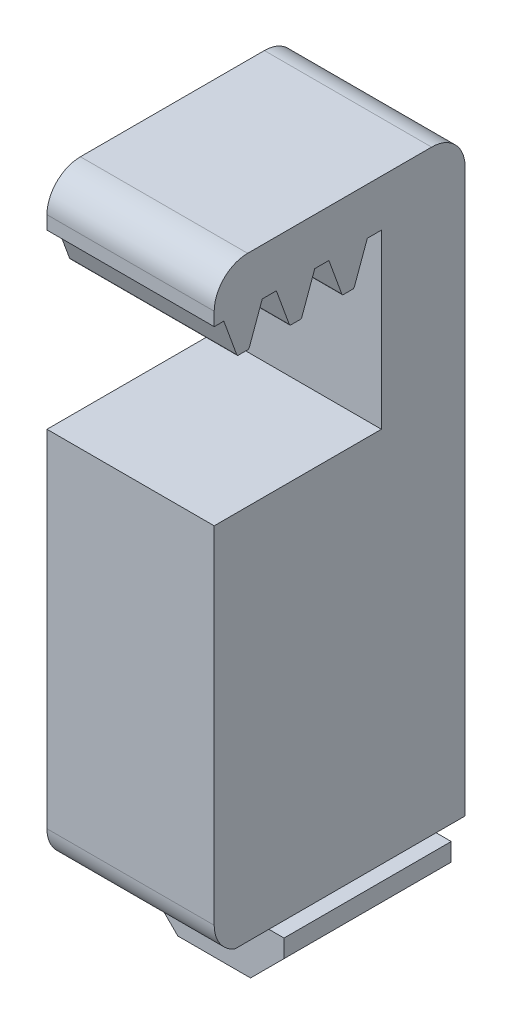
from build123d import *

# Parameters (mm, degrees)
BOSS_EXTRUDE1_DEPTH = 6.35
CUT_EXTRUDE1_DEPTH  = 51.905300863
LPATTERN1_COUNT     = 10
LPATTERN1_PITCH     = 3.989832
CUT_EXTRUDE2_DEPTH  = 50.702939108
FILLET1_R           = 2.54
CUT_EXTRUDE3_DEPTH  = 50.702939108
SKETCH6_W           = 12.7
SKETCH6_H           = 0.396875
CUT_EXTRUDE4_DEPTH  = 51.905300863


with BuildPart() as part:
    # Sketch1 → Boss-Extrude1 (new, symmetric)
    with BuildSketch(Plane(origin=(0, 0, 0), x_dir=(0, 0, -1), z_dir=(1, 0, 0))):
        Polygon((6.35, 0), (6.35, -6.096), (19.05, -6.096), (19.05, 45.466), (12.7, 45.466), (0, 45.466), (0, 39.116), (12.7, 39.116), (12.7, 29.21), (0, 29.21), (0, 0), align=None)
    extrude(amount=BOSS_EXTRUDE1_DEPTH, both=True)

    # Sketch2 → Cut-Extrude1 (cut, through all)
    with BuildSketch(Plane(origin=(6.35, 0, 0), x_dir=(0, 0, -1), z_dir=(1, 0, 0))):
        with BuildLine():
            Line((3.649904395, 41.91), (4.720336, 41.91))
            Line((4.720336, 41.91), (5.694793618, 39.232699698))
            ThreePointArc((5.694793618, 39.232699698), (5.787994572, 39.11123785), (5.934007978, 39.0652))
            Line((5.934007978, 39.0652), (6.426064417, 39.0652))
            ThreePointArc((6.426064417, 39.0652), (6.572077823, 39.11123785), (6.665278777, 39.232699698))
            Line((6.665278777, 39.232699698), (7.639736395, 41.91))
            Line((7.639736395, 41.91), (8.710168, 41.91))
            Line((8.710168, 41.91), (9.684625618, 39.232699698))
            ThreePointArc((9.684625618, 39.232699698), (9.777826572, 39.11123785), (9.923839978, 39.0652))
            Line((9.923839978, 39.0652), (10.415896417, 39.0652))
            ThreePointArc((10.415896417, 39.0652), (10.561909823, 39.11123785), (10.655110777, 39.232699698))
            Line((10.655110777, 39.232699698), (11.629568395, 41.91))
            Line((11.629568395, 41.91), (12.7, 41.91))
            Line((12.7, 41.91), (12.7, 29.21))
            Line((12.7, 29.21), (3.649904395, 29.21))
            Line((3.649904395, 29.21), (3.649904395, 41.91))
        make_face()
    cut_extrude1 = extrude(amount=-CUT_EXTRUDE1_DEPTH, mode=Mode.SUBTRACT)

    # LPattern1: Cut-Extrude1 ×10
    with Locations(*[(0, 0, i * LPATTERN1_PITCH) for i in range(1, LPATTERN1_COUNT)]):
        add(cut_extrude1, mode=Mode.SUBTRACT)

    # Sketch3 → Cut-Extrude2 (cut, through all)
    with BuildSketch(Plane(origin=(0, 0, -19.05), x_dir=(-1, 0, 0), z_dir=(0, 0, -1))):
        Polygon((-6.35, -6.096), (-2.839339828, -6.1), (-5.5, -3.439339828), (-5.5, -1.8), (-3.125, -1.8), (-3.125, -1.455), (-4.58, 0), (-9.5, 0), align=None)
        Polygon((2.839339828, -6.1), (6.35, -6.096), (15.42, 0), (4.58, 0), (3.125, -1.455), (3.125, -1.8), (5.5, -1.8), (5.5, -3.439339828), align=None)
    extrude(amount=-CUT_EXTRUDE2_DEPTH, mode=Mode.SUBTRACT)

    # Fillet1
    fillet1_edges = [part.edges().sort_by_distance(p)[0] for p in [
        (0, 0, 0),
        (0, 45.466, 0),
        (0, 45.466, -19.05),
    ]]
    fillet(fillet1_edges, radius=FILLET1_R)

    # Sketch5 → Cut-Extrude3 (cut, through all)
    with BuildSketch(Plane(origin=(0, 0, -19.05), x_dir=(-1, 0, 0), z_dir=(0, 0, -1))):
        Polygon((6.35, 0), (4.58, 0), (3.125, -1.455), (3.125, -1.8), (5.5, -1.8), (5.5, -3.439339828), (2.843339828, -6.096), (-2.843339828, -6.096), (-5.5, -3.439339828), (-5.5, -1.8), (-3.125, -1.8), (-3.125, -1.455), (-4.58, 0), (-6.35, 0), (-6.35, 0.1984375), (-4.497804496, 0.1984375), (-2.9265625, -1.372804496), (-2.9265625, -1.9984375), (-5.3015625, -1.9984375), (-5.3015625, -3.357144324), (-2.761144324, -5.8975625), (2.761144324, -5.8975625), (5.3015625, -3.357144324), (5.3015625, -1.9984375), (2.9265625, -1.9984375), (2.9265625, -1.372804496), (4.497804496, 0.1984375), (6.35, 0.1984375), align=None)
    extrude(amount=-CUT_EXTRUDE3_DEPTH, mode=Mode.SUBTRACT)

    # Sketch6 → Cut-Extrude4 (cut, through all)
    with BuildSketch(Plane(origin=(6.35, 0, 0), x_dir=(0, 0, -1), z_dir=(1, 0, 0))):
        with Locations((6.35, 29.0115625)):
            Rectangle(SKETCH6_W, SKETCH6_H)
    extrude(amount=-CUT_EXTRUDE4_DEPTH, mode=Mode.SUBTRACT)


solid = part.part
